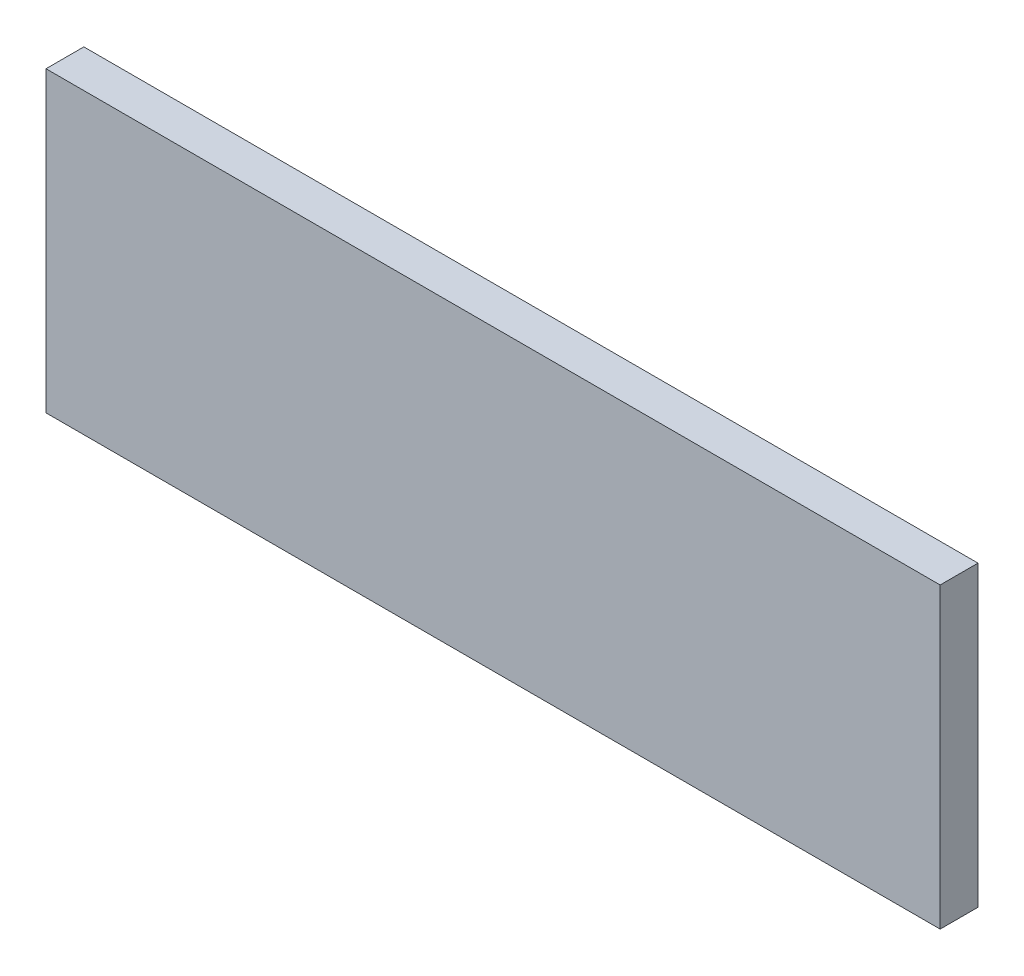
from build123d import *

# Parameters (mm, degrees)
SKETCH1_W           = 150
SKETCH1_H           = 50
BOSS_EXTRUDE1_DEPTH = 6.35


with BuildPart() as part:
    # Sketch1 → Boss-Extrude1 (new body)
    with BuildSketch(Plane.XY):
        with Locations((75, -25)):
            Rectangle(SKETCH1_W, SKETCH1_H)
    extrude(amount=BOSS_EXTRUDE1_DEPTH)


solid = part.part
